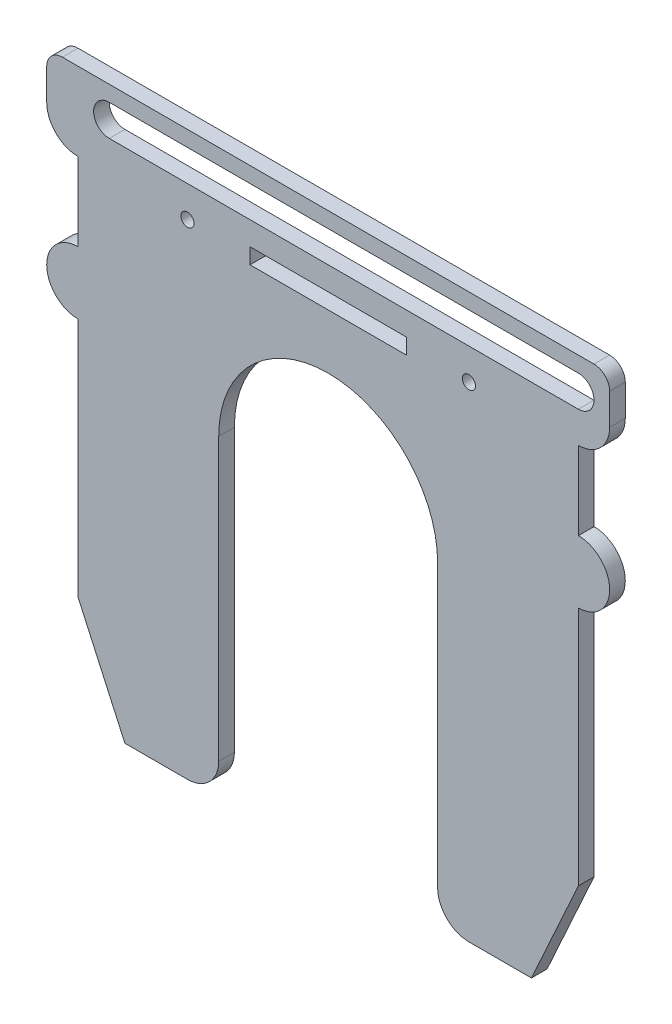
from build123d import *

# Parameters (mm, degrees)
BOSS_EXTRUDE1_DEPTH = 5
SKETCH2_R           = 2.1
SKETCH2_W           = 50
SKETCH2_H           = 5
CUT_EXTRUDE1_DEPTH  = 10
CUT_EXTRUDE2_DEPTH  = 10
CUT_EXTRUDE3_DEPTH  = 10
FILLET1_R           = 10
BOSS_EXTRUDE2_DEPTH = 5


with BuildPart() as part:
    # Sketch1 → Boss-Extrude1 (new body)
    with BuildSketch(Plane.XY):
        with BuildLine():
            Line((-10, 0), (-45, 0))
            ThreePointArc((-45, 0), (-52.071067812, 2.928932188), (-55, 10))
            Line((-55, 10), (-55, 100))
            ThreePointArc((-55, 100), (-90, 135), (-125, 100))
            Line((-125, 100), (-125, 10))
            ThreePointArc((-125, 10), (-127.928932188, 2.928932188), (-135, 0))
            Line((-135, 0), (-170, 0))
            ThreePointArc((-170, 0), (-177.071067812, 2.928932188), (-180, 10))
            Line((-180, 10), (-180, 175))
            ThreePointArc((-180, 175), (-178.535533906, 178.535533906), (-175, 180))
            Line((-175, 180), (-5, 180))
            ThreePointArc((-5, 180), (-1.464466094, 178.535533906), (0, 175))
            Line((0, 175), (0, 10))
            ThreePointArc((0, 10), (-2.928932188, 2.928932188), (-10, 0))
        make_face()
        with BuildLine():
            Line((-160, 175), (-10, 175))
            ThreePointArc((-10, 175), (-5, 170), (-10, 165))
            Line((-10, 165), (-160, 165))
            ThreePointArc((-160, 165), (-165, 170), (-160, 175))
        make_face(mode=Mode.SUBTRACT)
    extrude(amount=BOSS_EXTRUDE1_DEPTH)

    # Sketch2 → Cut-Extrude1 (cut)
    with BuildSketch(Plane.XY.offset(5)):
        with Locations((-135, 155)):
            Circle(SKETCH2_R)
        with Locations((-45, 155)):
            Circle(SKETCH2_R)
        with Locations((-90, 155)):
            Rectangle(SKETCH2_W, SKETCH2_H)
    extrude(amount=-CUT_EXTRUDE1_DEPTH, mode=Mode.SUBTRACT)

    # Sketch3 → Cut-Extrude2 (cut)
    with BuildSketch(Plane.XY.offset(5)):
        Polygon((0, 55), (0, 0), (-25, 0), align=None)
        Polygon((-155, 0), (-180, 55), (-180, 0), align=None)
    extrude(amount=-CUT_EXTRUDE2_DEPTH, mode=Mode.SUBTRACT)

    # Sketch4 → Cut-Extrude3 (cut)
    with BuildSketch(Plane.XY.offset(5)):
        Polygon((0, 155), (-10, 155), (-10, 33), (0, 55), align=None)
        Polygon((-180, 55), (-170, 33), (-170, 155), (-180, 155), align=None)
    extrude(amount=-CUT_EXTRUDE3_DEPTH, mode=Mode.SUBTRACT)

    # Fillet1
    fillet1_edges = [part.edges().sort_by_distance(p)[0] for p in [
        (0, 155, 2.5),
        (-180, 155, 2.5),
    ]]
    fillet(fillet1_edges, radius=FILLET1_R - 0.0001)  # a hair under: the kernel refuses the full size

    # Sketch5 → Boss-Extrude2 (add)
    with BuildSketch(Plane.XY.offset(5)):
        with BuildLine():
            Line((-10, 130), (-10, 110))
            ThreePointArc((-10, 110), (0, 120), (-10, 130))
        make_face()
    boss_extrude2 = extrude(amount=-BOSS_EXTRUDE2_DEPTH)

    # Mirror1: Boss-Extrude2 across plane
    add(boss_extrude2.mirror(Plane(origin=(-90, 0, 0), x_dir=(0, 0, 1), z_dir=(1, 0, 0))))


solid = part.part
